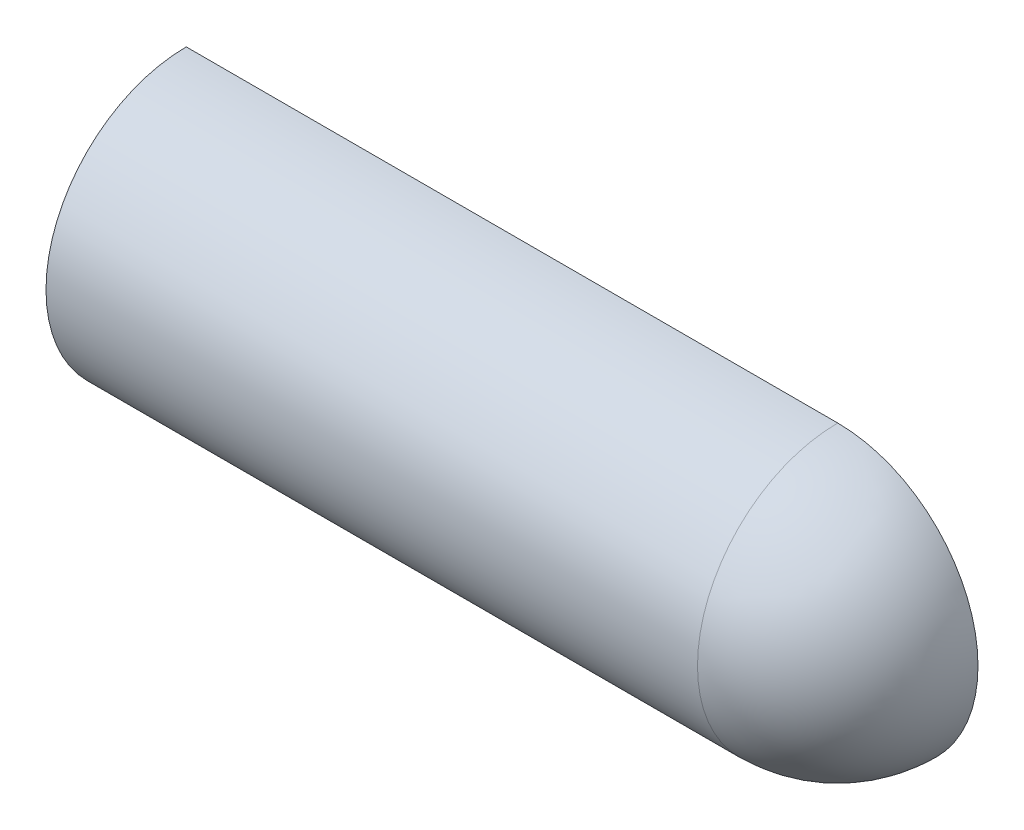
from build123d import *

# Parameters (mm, degrees)
REVOLVE1_ANGLE = 180


with BuildPart() as part:
    # Sketch2 → Revolve1 (revolve)
    with BuildSketch(Plane.XY):
        with BuildLine():
            Line((26, 0), (31, 0))
            ThreePointArc((31, 0), (21.920310217, 21.920310217), (0, 31))
            Line((0, 31), (-144, 31))
            Line((-144, 31), (-144, 26))
            Line((-144, 26), (0, 26))
            ThreePointArc((0, 26), (18.384776311, 18.384776311), (26, 0))
        make_face()
    revolve(axis=Axis((26, 0, 0), (1, 0, 0)), revolution_arc=REVOLVE1_ANGLE)


solid = part.part
